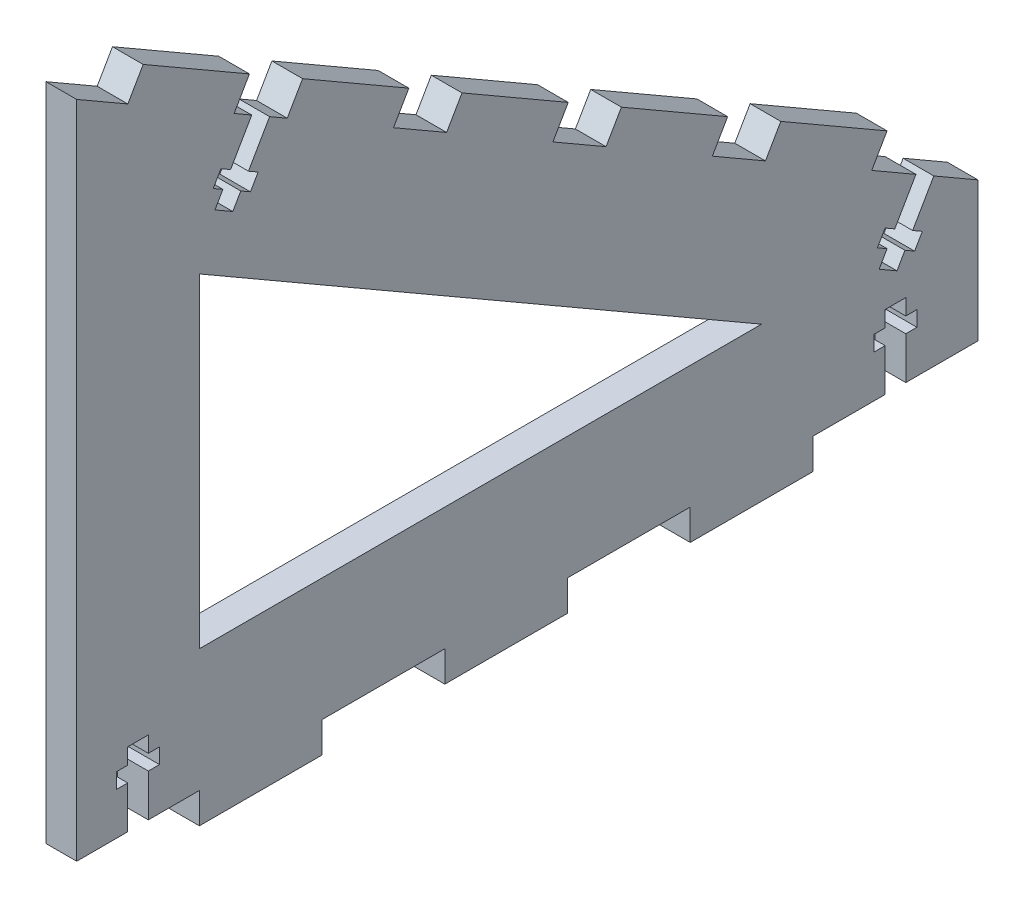
from build123d import *

# Parameters (mm, degrees)
BOSS_EXTRUDE1_DEPTH = 3.175
CUT_EXTRUDE1_DEPTH  = 6.35
SKETCH3_W           = 6.35
SKETCH3_H           = 25.4
BOSS_EXTRUDE2_DEPTH = 6.35
LPATTERN1_COUNT     = 5
LPATTERN1_PITCH     = 38.1
SKETCH4_W           = 6.35
SKETCH4_H           = 25.4
BOSS_EXTRUDE3_DEPTH = 6.35
LPATTERN2_COUNT     = 3
LPATTERN2_PITCH     = 50.8
CUT_EXTRUDE2_DEPTH  = 6.35
CUT_EXTRUDE3_DEPTH  = 6.35


with BuildPart() as part:
    # Sketch1 → Boss-Extrude1 (new, symmetric)
    with BuildSketch(Plane.ZY.offset(32.038437852)):
        Polygon((-215.9, 95.25), (-215.9, 124.1125), (-29.333338138, 231.826812448), (-29.333338138, 95.25), align=None)
    extrude(amount=BOSS_EXTRUDE1_DEPTH, both=True)

    # Sketch2 → Cut-Extrude1 (cut)
    with BuildSketch(Plane.ZY.offset(35.213437852)):
        Polygon((-54.733338138, 120.65), (-54.733338138, 187.832721936), (-171.097225921, 120.65), align=None)
    extrude(amount=-CUT_EXTRUDE1_DEPTH, mode=Mode.SUBTRACT)

    # Sketch3 → Boss-Extrude2 (add)
    with BuildSketch(Plane(origin=(0, 186.571817339, -107.717288964), x_dir=(1, 0, 0), z_dir=(0, 0.8660254037844386, -0.5000000000000001))):
        with Locations((-32.038437852, 86.818634677)):
            Rectangle(SKETCH3_W, SKETCH3_H)
    boss_extrude2 = extrude(amount=BOSS_EXTRUDE2_DEPTH)

    # LPattern1: Boss-Extrude2 ×5
    with Locations(*[Vector(0, 0.5000000000000004, 0.8660254037844385) * (i * LPATTERN1_PITCH) for i in range(1, LPATTERN1_COUNT)]):
        add(boss_extrude2)

    # Sketch4 → Boss-Extrude3 (add)
    with BuildSketch(Plane.XZ.offset(-95.25)):
        with Locations((-32.038437852, -67.433338138)):
            Rectangle(SKETCH4_W, SKETCH4_H)
    boss_extrude3 = extrude(amount=BOSS_EXTRUDE3_DEPTH)

    # LPattern2: Boss-Extrude3 ×3
    with Locations(*[(0, 0, -i * LPATTERN2_PITCH) for i in range(1, LPATTERN2_COUNT)]):
        add(boss_extrude3)

    # Sketch5 → Cut-Extrude2 (cut)
    with BuildSketch(Plane(origin=(-28.863437852, 0, 0), x_dir=(0, 0, -1), z_dir=(1, 0, 0))):
        Polygon((196.683069069, 95.25), (200.950269069, 95.25), (200.950269069, 104.013), (203.261669069, 104.013), (203.261669069, 107.188), (200.950269069, 107.188), (200.950269069, 110.49), (196.683069069, 110.49), (196.683069069, 107.188), (194.371669069, 107.188), (194.371669069, 104.013), (196.683069069, 104.013), align=None)
        Polygon((39.899738138, 95.25), (44.166938138, 95.25), (44.166938138, 104.013), (46.478338138, 104.013), (46.478338138, 107.188), (44.166938138, 107.188), (44.166938138, 110.49), (39.899738138, 110.49), (39.899738138, 107.188), (37.588338138, 107.188), (37.588338138, 104.013), (39.899738138, 104.013), align=None)
    extrude(amount=-CUT_EXTRUDE2_DEPTH, mode=Mode.SUBTRACT)

    # Sketch6 → Cut-Extrude3 (cut)
    with BuildSketch(Plane(origin=(-28.863437852, 0, 0), x_dir=(0, 0, -1), z_dir=(1, 0, 0))):
        Polygon((206.749229173, 129.3957), (203.05372557, 131.5293), (198.67222557, 123.940319387), (196.670494452, 125.096019387), (195.082994452, 122.34638873), (197.08472557, 121.19068873), (195.43372557, 118.331072846), (199.129229173, 116.197472846), (200.780229173, 119.05708873), (202.781960292, 117.90138873), (204.369460292, 120.651019387), (202.367729173, 121.806719387), align=None)
        Polygon((69.267696323, 208.7707), (65.57219272, 210.9043), (61.19069272, 203.315319387), (59.188961601, 204.471019387), (57.601461601, 201.72138873), (59.60319272, 200.56568873), (57.95219272, 197.706072846), (61.647696323, 195.572472846), (63.298696323, 198.43208873), (65.300427441, 197.27638873), (66.887927441, 200.026019387), (64.886196323, 201.181719387), align=None)
    extrude(amount=-CUT_EXTRUDE3_DEPTH, mode=Mode.SUBTRACT)


solid = part.part
